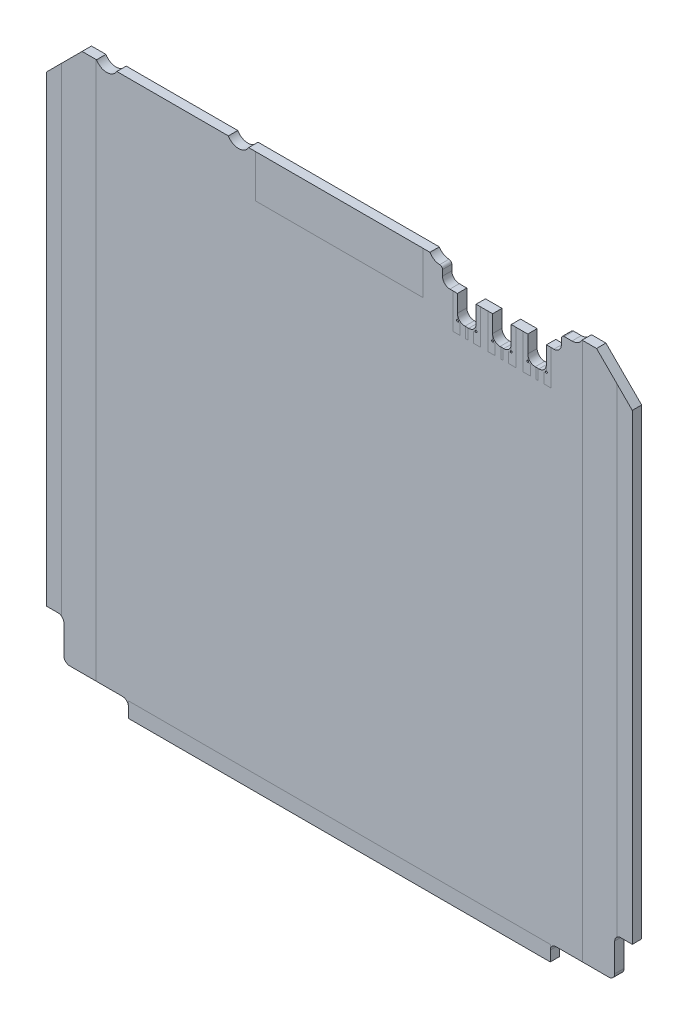
from build123d import *

# Parameters (mm, degrees)
SKETCH1_W                            = 100
SKETCH1_H                            = 94.625
BASICSIZE_DEPTH                      = 1.6
CHAMFER1_SIZE                        = 6.1
BACKPLANESIDESCREWCUTOUT_DEPTH       = 71.728777736
LPATTERN3_COUNT                      = 2
LPATTERN3_PITCH                      = 22.5
MIRROR3_COPY_1_DEPTH                 = 71.728777736
MIRROR3_COPY_2_DEPTH                 = 71.728777736
CUT_EXTRUDE4_DEPTH                   = 71.728777736
FILLET1_R                            = 1
FILLET1_OF_MIRROR1_R                 = 1
SKETCH7_W                            = 28.575
SKETCH7_H                            = 7.293
TIGEREYEFOOTPRINT_DEPTH              = 0.0001
THERMALCONTACTS_UPPER_W              = 8.992158269
THERMALCONTACTS_UPPER_H              = 86.125
KEEPOUT_BOTTOM_DEPTH                 = 0.0001
CAUTION_TOP_START                    = -0.00015
CAUTION_TOP_DEPTH                    = 0.00015
HOLD_DOWNLOCATIONS_W                 = 72
HOLD_DOWNLOCATIONS_H                 = 2.6
HOLD_DOWNFOOTPRINTS_DEPTH            = 0.0001
CLEARANCES_SIDE_SIDE_COPY_1_SKETCH_W = 8.992158269
CLEARANCES_SIDE_SIDE_COPY_1_SKETCH_H = 86.125
CLEARANCES_SIDE_SIDE_COPY_1_DEPTH    = 0.0001
CLEARANCES_SIDE_SIDE_START           = -0.00015
CLEARANCES_SIDE_SIDE_COPY_2_DEPTH    = 0.00015
CLEARANCES_SIDE_SIDE_COPY_3_SKETCH_W = 8.992158269
CLEARANCES_SIDE_SIDE_COPY_3_SKETCH_H = 86.125
CLEARANCES_SIDE_SIDE_COPY_3_DEPTH    = 0.0001
CLEARANCES_SIDE_SIDE_COPY_4_DEPTH    = 0.00015
SKETCH11_W                           = 3.18
SKETCH11_H                           = 4.2
CUT_EXTRUDE5_DEPTH                   = 10
FILLET2_R                            = 1.27
F_0_32_0_32_DIAMETER_HOLE1_D         = 0.32
F_0_32_0_32_DIAMETER_HOLE1_DEPTH     = 9.525
F_0_32_0_32_DIAMETER_HOLE1_TIP       = 0.096137699
SKETCH14_W                           = 0.38
SKETCH14_H                           = 1.79
BOSS_EXTRUDE1_DEPTH                  = 0.0001
LPATTERN4_COUNT                      = 3
LPATTERN4_PITCH                      = 6
CUT_EXTRUDE6_DEPTH                   = 71.728777736
CUT_EXTRUDE6_DEPTH_BACK              = 71.728777736
FILLET3_R                            = 0.5


with BuildPart() as part:
    # Sketch1 → basicSize (new body)
    with BuildSketch(Plane(origin=(0, 0, -0.0125), x_dir=(-1, 0, 0), z_dir=(0, 0, -1))):
        with Locations((0, -2.6875)):
            Rectangle(SKETCH1_W, SKETCH1_H)
    extrude(amount=-BASICSIZE_DEPTH)

    # Chamfer1
    chamfer1_edges = [part.edges().sort_by_distance(p)[0] for p in [
        (50, 44.625, 0.7875),
        (-50, 44.625, 0.7875),
    ]]
    chamfer(chamfer1_edges, length=CHAMFER1_SIZE)

    # Sketch4 → backplaneSideScrewCutout (cut, symmetric)
    with BuildSketch(Plane.XY.offset(1.5875)):
        with BuildLine():
            Line((37.967949192, 44.625), (41.432050808, 44.625))
            ThreePointArc((41.432050808, 44.625), (39.7, 43.625), (37.967949192, 44.625))
        make_face()
    backplanesidescrewcutout = extrude(amount=BACKPLANESIDESCREWCUTOUT_DEPTH, both=True, mode=Mode.SUBTRACT)

    # LPattern3: backplaneSideScrewCutout ×2
    with Locations(*[(-i * LPATTERN3_PITCH, 0, 0) for i in range(1, LPATTERN3_COUNT)]):
        add(backplanesidescrewcutout, mode=Mode.SUBTRACT)

    # Mirror3 copy 1 sketch → Mirror3 copy 1 (cut, symmetric)
    with BuildSketch(Plane(origin=(22.5, 0, 1.5875), x_dir=(-1, 0, 0), z_dir=(0, 0, 1))):
        with BuildLine():
            Line((37.967949192, -44.625), (41.432050808, -44.625))
            ThreePointArc((41.432050808, -44.625), (39.7, -43.625), (37.967949192, -44.625))
        make_face()
    extrude(amount=MIRROR3_COPY_1_DEPTH, both=True, mode=Mode.SUBTRACT)

    # Mirror3 copy 2 sketch → Mirror3 copy 2 (cut, symmetric)
    with BuildSketch(Plane(origin=(0, 0, 1.5875), x_dir=(-1, 0, 0), z_dir=(0, 0, 1))):
        with BuildLine():
            Line((37.967949192, -44.625), (41.432050808, -44.625))
            ThreePointArc((41.432050808, -44.625), (39.7, -43.625), (37.967949192, -44.625))
        make_face()
    extrude(amount=MIRROR3_COPY_2_DEPTH, both=True, mode=Mode.SUBTRACT)

    # Sketch6 → Cut-Extrude4 (cut, through all)
    with BuildSketch(Plane.XY.offset(1.5875)):
        Polygon((-50, -40.4), (-47, -40.4), (-47, -47.25), (-36, -47.25), (-36, -50), (-50, -50), align=None)
    cut_extrude4 = extrude(amount=-CUT_EXTRUDE4_DEPTH, mode=Mode.SUBTRACT)

    # Fillet1
    fillet1_edges = [part.edges().sort_by_distance(p)[0] for p in [
        (-36, -47.25, 0.7875),
        (-47, -47.25, 0.7875),
        (-47, -40.4, 0.7875),
    ]]
    fillet(fillet1_edges, radius=FILLET1_R)

    # Mirror1: Cut-Extrude4 across plane
    add(cut_extrude4.mirror(Plane(origin=(0, 0, 0), x_dir=(0, 0, 1), z_dir=(1, 0, 0))), mode=Mode.SUBTRACT)

    # Fillet1 of Mirror1
    fillet1_of_mirror1_edges = [part.edges().sort_by_distance(p)[0] for p in [
        (36, -47.25, 0.7875),
        (47, -47.25, 0.7875),
        (47, -40.4, 0.7875),
    ]]
    fillet(fillet1_of_mirror1_edges, radius=FILLET1_OF_MIRROR1_R)

    # Sketch7 → TigerEyeFootprint (cut)
    with BuildSketch(Plane.XY.offset(1.5875)):
        with Locations((0, 40.9785)):
            Rectangle(SKETCH7_W, SKETCH7_H)
    extrude(amount=-TIGEREYEFOOTPRINT_DEPTH, mode=Mode.SUBTRACT)

    # thermalContacts_upper → keepOut_bottom (cut)
    with BuildSketch(Plane.XY.offset(1.5875)):
        with Locations((-51.896079135, 1.5625)):
            Rectangle(THERMALCONTACTS_UPPER_W, THERMALCONTACTS_UPPER_H)
    keepout_bottom = extrude(amount=-KEEPOUT_BOTTOM_DEPTH, mode=Mode.SUBTRACT)

    # Sketch3 → caution_top (cut)
    with BuildSketch(Plane.XY.offset(1.5875).offset(CAUTION_TOP_START)):
        with BuildLine():
            Line((-47.4, -41.4), (-47, -41.4))
            Line((-47, -41.4), (-47, -46.25))
            ThreePointArc((-47, -46.25), (-46.707106781, -46.957106781), (-46, -47.25))
            Line((-46, -47.25), (-41.5, -47.25))
            Line((-41.5, -47.25), (-41.5, 44.625))
            Line((-41.5, 44.625), (-47.4, 44.625))
            Line((-47.4, 44.625), (-47.4, -41.4))
        make_face()
    caution_top = extrude(amount=CAUTION_TOP_DEPTH, mode=Mode.SUBTRACT)

    # hold-downLocations → hold-downFootprints (cut)
    with BuildSketch(Plane.XY.offset(1.5875)):
        with Locations((0, -48.7)):
            Rectangle(HOLD_DOWNLOCATIONS_W, HOLD_DOWNLOCATIONS_H)
    hold_downfootprints = extrude(amount=-HOLD_DOWNFOOTPRINTS_DEPTH, mode=Mode.SUBTRACT)

    # clearances_top-bottom: keepOut_bottom, caution_top across plane
    add(keepout_bottom.mirror(Plane.XY.offset(0.7875)), mode=Mode.SUBTRACT)
    add(caution_top.mirror(Plane.XY.offset(0.7875)), mode=Mode.SUBTRACT)

    # clearances_side-side copy 1 sketch → clearances_side-side copy 1 (cut)
    with BuildSketch(Plane(origin=(0, 0, -0.0125), x_dir=(-1, 0, 0), z_dir=(0, 0, -1))):
        with Locations((-51.896079135, 1.5625)):
            Rectangle(CLEARANCES_SIDE_SIDE_COPY_1_SKETCH_W, CLEARANCES_SIDE_SIDE_COPY_1_SKETCH_H)
    extrude(amount=-CLEARANCES_SIDE_SIDE_COPY_1_DEPTH, mode=Mode.SUBTRACT)

    # clearances_side-side copy 2 sketch → clearances_side-side copy 2 (cut)
    with BuildSketch(Plane(origin=(0, 0, -0.0125), x_dir=(-1, 0, 0), z_dir=(0, 0, -1)).offset(CLEARANCES_SIDE_SIDE_START)):
        with BuildLine():
            Line((-47.4, -41.4), (-47, -41.4))
            Line((-47, -41.4), (-47, -46.25))
            ThreePointArc((-47, -46.25), (-46.707106781, -46.957106781), (-46, -47.25))
            Line((-46, -47.25), (-41.5, -47.25))
            Line((-41.5, -47.25), (-41.5, 44.625))
            Line((-41.5, 44.625), (-47.4, 44.625))
            Line((-47.4, 44.625), (-47.4, -41.4))
        make_face()
    extrude(amount=CLEARANCES_SIDE_SIDE_COPY_2_DEPTH, mode=Mode.SUBTRACT)

    # clearances_side-side copy 3 sketch → clearances_side-side copy 3 (cut)
    with BuildSketch(Plane(origin=(0, 0, 1.5875), x_dir=(-1, 0, 0), z_dir=(0, 0, 1))):
        with Locations((-51.896079135, -1.5625)):
            Rectangle(CLEARANCES_SIDE_SIDE_COPY_3_SKETCH_W, CLEARANCES_SIDE_SIDE_COPY_3_SKETCH_H)
    extrude(amount=-CLEARANCES_SIDE_SIDE_COPY_3_DEPTH, mode=Mode.SUBTRACT)

    # clearances_side-side copy 4 sketch → clearances_side-side copy 4 (cut)
    with BuildSketch(Plane(origin=(0, 0, 1.5875), x_dir=(-1, 0, 0), z_dir=(0, 0, 1)).offset(CLEARANCES_SIDE_SIDE_START)):
        with BuildLine():
            Line((-47.4, 41.4), (-47, 41.4))
            Line((-47, 41.4), (-47, 46.25))
            ThreePointArc((-47, 46.25), (-46.707106781, 46.957106781), (-46, 47.25))
            Line((-46, 47.25), (-41.5, 47.25))
            Line((-41.5, 47.25), (-41.5, -44.625))
            Line((-41.5, -44.625), (-47.4, -44.625))
            Line((-47.4, -44.625), (-47.4, 41.4))
        make_face()
    extrude(amount=CLEARANCES_SIDE_SIDE_COPY_4_DEPTH, mode=Mode.SUBTRACT)

    # Mirror6: hold-downFootprints across plane
    add(hold_downfootprints.mirror(Plane.XY.offset(0.7875)), mode=Mode.SUBTRACT)

    # Sketch11 → Cut-Extrude5 (cut)
    with BuildSketch(Plane.XY.offset(1.5875)):
        with Locations((33.75, 38.785)):
            Rectangle(SKETCH11_W, SKETCH11_H)
        with Locations((27.75, 38.785)):
            Rectangle(SKETCH11_W, SKETCH11_H)
        with Locations((21.75, 38.785)):
            Rectangle(SKETCH11_W, SKETCH11_H)
    extrude(amount=-CUT_EXTRUDE5_DEPTH, mode=Mode.SUBTRACT)

    # Fillet2
    fillet2_edges = [part.edges().sort_by_distance(p)[0] for p in [
        (23.34, 36.685, 0.7875),
        (29.34, 36.685, 0.7875),
        (35.34, 36.685, 0.7875),
        (32.16, 36.685, 0.7875),
        (26.16, 36.685, 0.7875),
        (20.16, 36.685, 0.7875),
    ]]
    fillet(fillet2_edges, radius=FILLET2_R)

    # Ø0.32 (0.32) Diameter Hole1
    with Locations(Plane.XY.offset(1.5875)):
        with Locations((35.34, 36.845), (32.16, 36.845), (29.34, 36.845), (26.16, 36.845), (23.34, 36.845), (20.16, 36.845)):
            Hole(F_0_32_0_32_DIAMETER_HOLE1_D / 2, depth=F_0_32_0_32_DIAMETER_HOLE1_DEPTH)
            with Locations((0, 0, -(F_0_32_0_32_DIAMETER_HOLE1_DEPTH + F_0_32_0_32_DIAMETER_HOLE1_TIP / 2))):  # 118° drill point
                Cone(0, F_0_32_0_32_DIAMETER_HOLE1_D / 2, F_0_32_0_32_DIAMETER_HOLE1_TIP, mode=Mode.SUBTRACT)

    # Sketch14 → Boss-Extrude1 (add)
    with BuildSketch(Plane.XY.offset(1.5875)):
        with BuildLine():
            Line((36.125, 34.895), (36.125, 40.885))
            Line((36.125, 40.885), (35.34, 40.885))
            Line((35.34, 40.885), (35.34, 37.005))
            ThreePointArc((35.34, 37.005), (35.5, 36.845), (35.34, 36.685))
            Line((35.34, 36.685), (34.895, 36.685))
            Line((34.895, 36.685), (34.895, 34.895))
            Line((34.895, 34.895), (36.125, 34.895))
        make_face()
        with BuildLine():
            Line((32.16, 40.885), (31.375, 40.885))
            Line((31.375, 40.885), (31.375, 34.895))
            Line((31.375, 34.895), (32.605, 34.895))
            Line((32.605, 34.895), (32.605, 36.685))
            Line((32.605, 36.685), (32.16, 36.685))
            ThreePointArc((32.16, 36.685), (32, 36.845), (32.16, 37.005))
            Line((32.16, 37.005), (32.16, 40.885))
        make_face()
        with Locations((33.75, 35.79)):
            Rectangle(SKETCH14_W, SKETCH14_H)
    boss_extrude1 = extrude(amount=BOSS_EXTRUDE1_DEPTH)

    # LPattern4: Boss-Extrude1 ×3
    with Locations(*[(-i * LPATTERN4_PITCH, 0, 0) for i in range(1, LPATTERN4_COUNT)]):
        add(boss_extrude1)

    # Sketch15 → Cut-Extrude6 (cut, two sides: drawn at the far end of the back side and taken through both)
    with BuildSketch(Plane.XY.offset(1.5875).offset(-CUT_EXTRUDE6_DEPTH_BACK)):
        with BuildLine():
            Line((17.605, 44.625), (37.895, 44.625))
            Line((37.895, 44.625), (39.7, 44.625))
            Line((39.7, 44.625), (39.7, 43.625))
            Line((39.7, 43.625), (37.895, 43.625))
            Line((37.895, 43.625), (37.895, 42.155))
            ThreePointArc((37.895, 42.155), (37.523025612, 41.256974388), (36.625, 40.885))
            Line((36.625, 40.885), (18.875, 40.885))
            ThreePointArc((18.875, 40.885), (17.976974388, 41.256974388), (17.605, 42.155))
            Line((17.605, 42.155), (17.605, 43.625))
            Line((17.605, 43.625), (17.2, 43.625))
            Line((17.2, 43.625), (17.2, 44.625))
            Line((17.2, 44.625), (17.605, 44.625))
        make_face()
    extrude(amount=CUT_EXTRUDE6_DEPTH + CUT_EXTRUDE6_DEPTH_BACK, mode=Mode.SUBTRACT)

    # Fillet3
    fillet3_edges = [part.edges().sort_by_distance(p)[0] for p in [
        (17.605, 43.625, 0.7875),
        (37.895, 43.625, 0.7875),
    ]]
    fillet(fillet3_edges, radius=FILLET3_R)


solid = part.part
